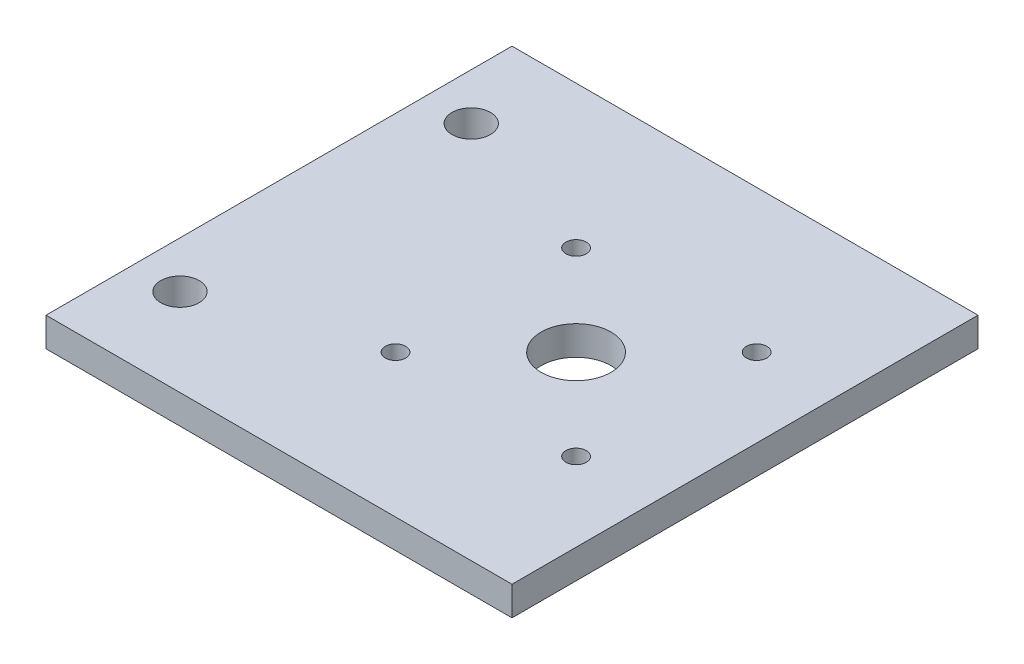
from build123d import *

# Parameters (mm, degrees)
SCHIZZO1_W                   = 80
SCHIZZO1_H                   = 5
ESTRUSIONE_ESTRUSIONE1_DEPTH = 80
FORO_PER_VITE_M6_1_D         = 6.6
SCHIZZO4_R                   = 6
TAGLIO_ESTRUSIONE1_DEPTH     = 114.247516529
SCHIZZO6_R                   = 1.75
TAGLIO_ESTRUSIONE3_DEPTH     = 114.247516529


with BuildPart() as part:
    # Schizzo1 → Estrusione-Estrusione1 (new body)
    with BuildSketch(Plane.XY):
        with Locations((40, 2.5)):
            Rectangle(SCHIZZO1_W, SCHIZZO1_H)
    extrude(amount=ESTRUSIONE_ESTRUSIONE1_DEPTH)

    # Foro per Vite M6-1 (through all)
    with Locations(Plane(origin=(0, 5, 0), x_dir=(1, 0, 0), z_dir=(0, 1, 0))):
        with Locations((8, -15), (8, -65)):
            Hole(FORO_PER_VITE_M6_1_D / 2)

    # Schizzo4 → Taglio-Estrusione1 (cut, through all)
    with BuildSketch(Plane(origin=(0, 5, 0), x_dir=(1, 0, 0), z_dir=(0, 1, 0))):
        with Locations((51, -40)):
            Circle(SCHIZZO4_R)
    extrude(amount=-TAGLIO_ESTRUSIONE1_DEPTH, mode=Mode.SUBTRACT)

    # Schizzo6 → Taglio-Estrusione3 (cut, through all)
    with BuildSketch(Plane(origin=(0, 5, 0), x_dir=(1, 0, 0), z_dir=(0, 1, 0))):
        with Locations((35.5, -24.5)):
            Circle(SCHIZZO6_R)
        with Locations((66.5, -24.5)):
            Circle(SCHIZZO6_R)
        with Locations((66.5, -55.5)):
            Circle(SCHIZZO6_R)
        with Locations((35.5, -55.5)):
            Circle(SCHIZZO6_R)
    extrude(amount=-TAGLIO_ESTRUSIONE3_DEPTH, mode=Mode.SUBTRACT)


solid = part.part
